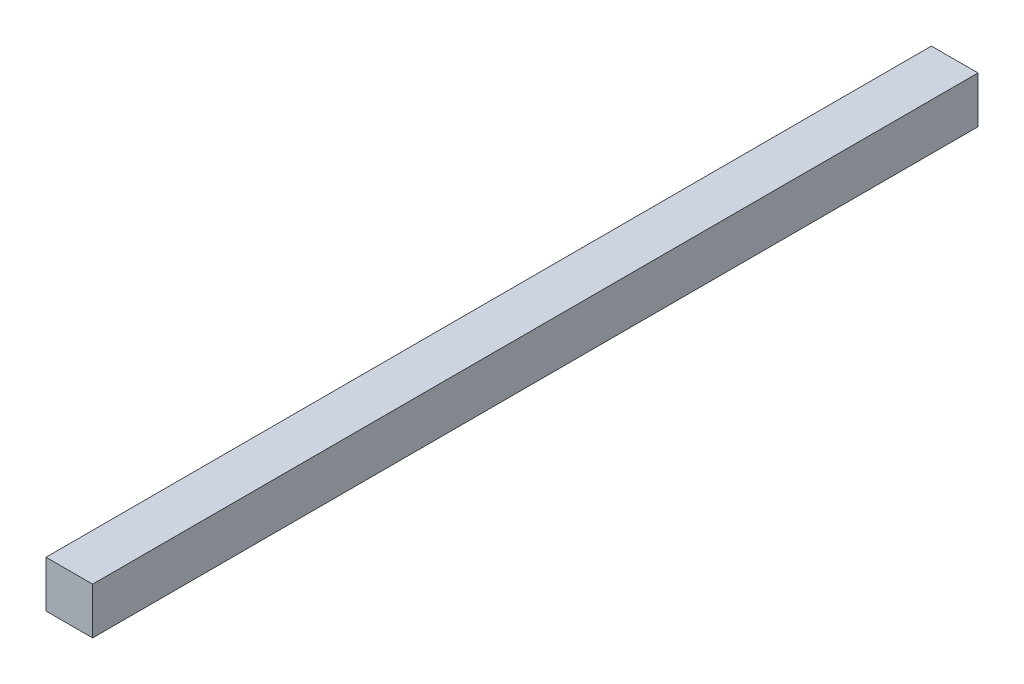
from build123d import *

# Parameters (mm, degrees)
SKIZZE1_W                       = 50
SKIZZE1_H                       = 50
AUFSATZ_LINEAR_AUSTRAGEN1_DEPTH = 950


with BuildPart() as part:
    # Skizze1 → Aufsatz-Linear austragen1 (new body)
    with BuildSketch(Plane.XY):
        with Locations((25, 25)):
            Rectangle(SKIZZE1_W, SKIZZE1_H)
    extrude(amount=AUFSATZ_LINEAR_AUSTRAGEN1_DEPTH)


solid = part.part
